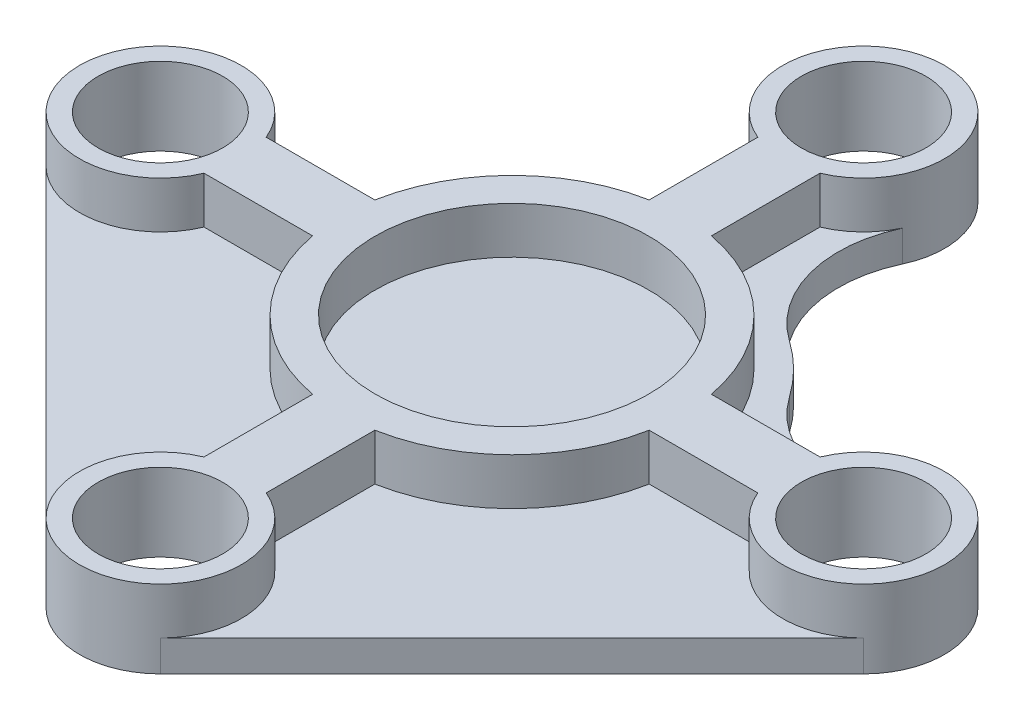
from build123d import *
from build123d.topology import SkipClean

# Parameters (mm, degrees)
BOSS_EXTRUDE1_DEPTH   = 10
SKETCH2_R             = 26
BOSS_EXTRUDE2_DEPTH   = 15
SKETCH3_R             = 55
SKETCH3_R_2           = 44
BOSS_EXTRUDE3_DEPTH   = 15
EXTRUDE_THIN1_START   = -15
EXTRUDE_THIN1_DEPTH   = 15
EXTRUDE_THIN2_START   = -15
EXTRUDE_THIN2_DEPTH   = 15
F_1_0MM_DOWEL_HOLE1_D = 40


# Read off the part's stored shape, not the designer's step: Extrude-Thin1, Extrude-Thin2
with BuildPart() as part:
    # Sketch1 → Boss-Extrude1 (new body)
    with BuildSketch(Plane(origin=(0, 0, 0), x_dir=(1, 0, 0), z_dir=(0, 1, 0))):
        with BuildLine():
            Line((18.384776311, -131.384776311), (131.384776311, -18.384776311))
            ThreePointArc((131.384776311, -18.384776311), (134.295069945, 14.917104144), (102.002815768, 23.559752524))
            ThreePointArc((102.002815768, 23.559752524), (74.773631801, 21.15717706), (52.359428182, 36.803400392))
            ThreePointArc((52.359428182, 36.803400392), (45.254833996, 45.254833996), (36.803400392, 52.359428182))
            ThreePointArc((36.803400392, 52.359428182), (21.15717706, 74.773631801), (23.559752524, 102.002815768))
            ThreePointArc((23.559752524, 102.002815768), (0, 139), (-23.559752524, 102.002815768))
            ThreePointArc((-23.559752524, 102.002815768), (-21.15717706, 74.773631801), (-36.803400392, 52.359428182))
            ThreePointArc((-36.803400392, 52.359428182), (-45.254833996, 45.254833996), (-52.359428182, 36.803400392))
            ThreePointArc((-52.359428182, 36.803400392), (-74.773631801, 21.15717706), (-102.002815768, 23.559752524))
            ThreePointArc((-102.002815768, 23.559752524), (-134.295069945, 14.917104144), (-131.384776311, -18.384776311))
            Line((-131.384776311, -18.384776311), (-18.384776311, -131.384776311))
            ThreePointArc((-18.384776311, -131.384776311), (0, -139), (18.384776311, -131.384776311))
        make_face()
    extrude(amount=BOSS_EXTRUDE1_DEPTH)

    # Sketch2 → Boss-Extrude2 (add)
    with BuildSketch(Plane(origin=(0, 10, 0), x_dir=(1, 0, 0), z_dir=(0, 1, 0))):
        with Locations(Location((0, 113, 0), (0, 0, 205.022151532))):
            Circle(SKETCH2_R)
        with Locations(Location((113, 0, 0), (0, 0, 115.022151532))):
            Circle(SKETCH2_R)
        with Locations(Location((-113, 0, 0), (0, 0, 64.977848468))):
            Circle(SKETCH2_R)
        with Locations(Location((0, -113, 0), (0, 0, 315))):
            Circle(SKETCH2_R)
    extrude(amount=BOSS_EXTRUDE2_DEPTH)

    # Sketch3 → Boss-Extrude3 (add)
    with BuildSketch(Plane(origin=(0, 10, 0), x_dir=(1, 0, 0), z_dir=(0, 1, 0))):
        with Locations(Location((0, 0, 0), (0, 0, 270))):
            Circle(SKETCH3_R)
        with Locations(Location((0, 0, 0), (0, 0, 270))):
            Circle(SKETCH3_R_2, mode=Mode.SUBTRACT)
    extrude(amount=BOSS_EXTRUDE3_DEPTH)

    # Extrude-Thin1 outline → Extrude-Thin1 (add)
    with SkipClean():  # the faces are left unmerged after this step: merging them gives an invalid solid
        with BuildSketch(Plane(origin=(0, 25, 0), x_dir=(1, 0, 0), z_dir=(0, 1, 0)).offset(EXTRUDE_THIN1_START)):
            with BuildLine():
                Line((-89, -10), (-54.083269132, -10))
                ThreePointArc((-54.083269132, -10), (-54.770337785, -5.02096593), (-55, 0))
                Line((-55, 0), (-87, 0))
                ThreePointArc((-87, 0), (-87.504902432, -5.099019514), (-89, -10))
            make_face()
            with BuildLine():
                ThreePointArc((10, -54.083269132), (0, -55), (-10, -54.083269132))
                Line((-10, -54.083269132), (-10, -89))
                ThreePointArc((-10, -89), (0, -87), (10, -89))
                Line((10, -89), (10, -54.083269132))
            make_face()
            with BuildLine():
                Line((87, 0), (55, 0))
                ThreePointArc((55, 0), (54.770337785, -5.02096593), (54.083269132, -10))
                Line((54.083269132, -10), (89, -10))
                ThreePointArc((89, -10), (87.504902432, -5.099019514), (87, 0))
            make_face()
        extrude(amount=EXTRUDE_THIN1_DEPTH)

    # Extrude-Thin2 outline → Extrude-Thin2 (add)
    with SkipClean():  # the faces are left unmerged after this step: merging them gives an invalid solid
        with BuildSketch(Plane(origin=(0, 25, 0), x_dir=(1, 0, 0), z_dir=(0, 1, 0)).offset(EXTRUDE_THIN2_START)):
            with BuildLine():
                Line((89, 10), (54.083269132, 10))
                ThreePointArc((54.083269132, 10), (54.770337785, 5.02096593), (55, 0))
                Line((55, 0), (87, 0))
                ThreePointArc((87, 0), (87.504902432, 5.099019514), (89, 10))
            make_face()
            with BuildLine():
                ThreePointArc((-55, 0), (-54.770337785, 5.02096593), (-54.083269132, 10))
                Line((-54.083269132, 10), (-89, 10))
                ThreePointArc((-89, 10), (-87.504902432, 5.099019514), (-87, 0))
                Line((-87, 0), (-55, 0))
            make_face()
            with BuildLine():
                Line((-10, 89), (-10, 54.083269132))
                ThreePointArc((-10, 54.083269132), (0, 55), (10, 54.083269132))
                Line((10, 54.083269132), (10, 89))
                ThreePointArc((10, 89), (0, 87), (-10, 89))
            make_face()
        extrude(amount=EXTRUDE_THIN2_DEPTH)

    # Ø1.0mm Dowel Hole1 (through all)
    with Locations(Plane(origin=(0, 25, 0), x_dir=(1, 0, 0), z_dir=(0, 1, 0))):
        with Locations((0, 113), (-113, 0), (113, 0), (0, -113)):
            Hole(F_1_0MM_DOWEL_HOLE1_D / 2)


solid = part.part
